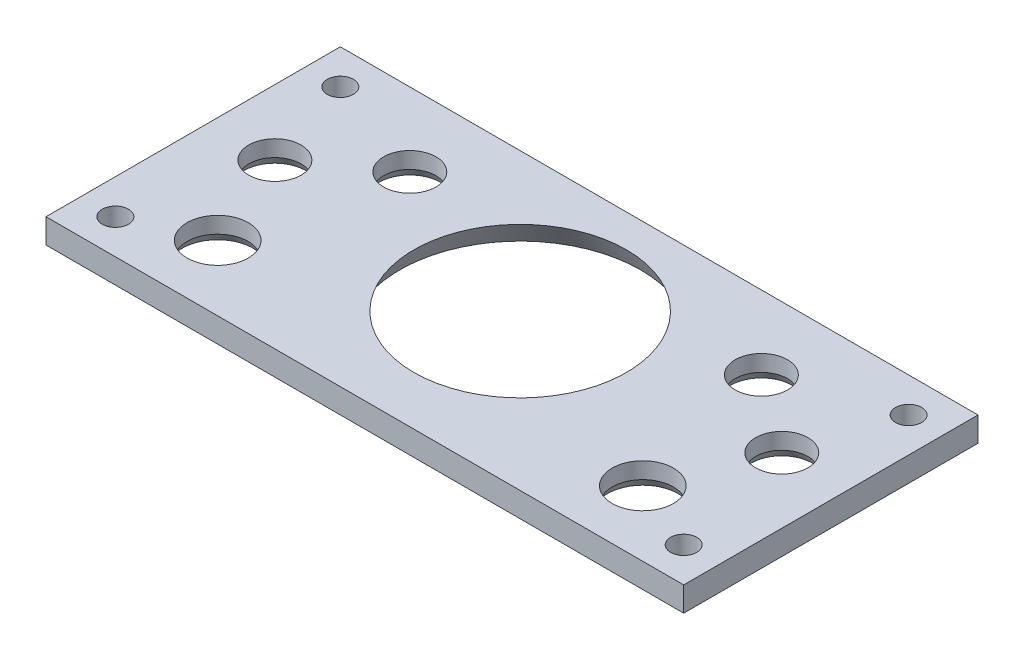
from build123d import *
from OCP.BRepFilletAPI import BRepFilletAPI_MakeChamfer

# Parameters (mm, degrees)
SKETCH1_W           = 78
SKETCH1_H           = 36
SKETCH1_R           = 13
SKETCH1_R_2         = 3.2
SKETCH1_R_3         = 3.75
BOSS_EXTRUDE1_DEPTH = 3
CHAMFER1_SIZE2      = 1.732050808
CHAMFER1_SIZE       = 3
CHAMFER2_SIZE       = 1
CHAMFER2_SIZE2      = 0.577350269
SKETCH2_R           = 1.6
CUT_EXTRUDE1_DEPTH  = 44.058100283


with BuildPart() as part:
    # Sketch1 → Boss-Extrude1 (new body)
    with BuildSketch(Plane(origin=(0, 0, 0), x_dir=(1, 0, 0), z_dir=(0, 1, 0))):
        Rectangle(SKETCH1_W, SKETCH1_H)
        with Locations(Location((0, 1, 0), (0, 0, 270))):
            Circle(SKETCH1_R, mode=Mode.SUBTRACT)
        with Locations(Location((-31, 2, 0), (0, 0, 270))):
            Circle(SKETCH1_R_2, mode=Mode.SUBTRACT)
        with Locations(Location((-26, -10, 0), (0, 0, 270))):
            Circle(SKETCH1_R_3, mode=Mode.SUBTRACT)
        with Locations(Location((31, 2, 0), (0, 0, 270))):
            Circle(SKETCH1_R_2, mode=Mode.SUBTRACT)
        with Locations(Location((26, -10, 0), (0, 0, 270))):
            Circle(SKETCH1_R_3, mode=Mode.SUBTRACT)
        with Locations(Location((21.5, 9, 0), (0, 0, 270))):
            Circle(SKETCH1_R_2, mode=Mode.SUBTRACT)
        with Locations(Location((-21.5, 9, 0), (0, 0, 270))):
            Circle(SKETCH1_R_2, mode=Mode.SUBTRACT)
    extrude(amount=BOSS_EXTRUDE1_DEPTH)

    # Chamfer1
    chamfer1_edges = [part.edges().sort_by_distance(p)[0] for p in [
        (0, 0, -14),
    ]]
    chamfer1_side = [part.faces().sort_by_distance(p)[0] for p in [
        (0, 0.034641016, -14),
    ]]
    chamfer(chamfer1_edges, length=CHAMFER1_SIZE - 0.0001, length2=CHAMFER1_SIZE2 - 0.0001, reference=chamfer1_side[0])  # a hair under: the kernel refuses the full size

    # Chamfer2: one chamfer whose edges measure the first distance from different faces: ONE call of the kernel's chamfer builder (chamfer() names one face for all edges)
    chamfer2_edges_1 = [part.edges().sort_by_distance(p)[0] for p in [
        (-31, 0, -5.2),
    ]]
    chamfer2_side_1 = [part.faces().sort_by_distance(p)[0] for p in [
        (-31, 1.5, -5.2),
    ]]
    chamfer2_edges_2 = [part.edges().sort_by_distance(p)[0] for p in [
        (-26, 0, 6.25),
    ]]
    chamfer2_side_2 = [part.faces().sort_by_distance(p)[0] for p in [
        (-26, 1.5, 6.25),
    ]]
    chamfer2_edges_3 = [part.edges().sort_by_distance(p)[0] for p in [
        (31, 0, -5.2),
    ]]
    chamfer2_side_3 = [part.faces().sort_by_distance(p)[0] for p in [
        (31, 1.5, -5.2),
    ]]
    chamfer2_edges_4 = [part.edges().sort_by_distance(p)[0] for p in [
        (26, 0, 6.25),
    ]]
    chamfer2_side_4 = [part.faces().sort_by_distance(p)[0] for p in [
        (26, 1.5, 6.25),
    ]]
    chamfer2_edges_5 = [part.edges().sort_by_distance(p)[0] for p in [
        (21.5, 0, -12.2),
    ]]
    chamfer2_side_5 = [part.faces().sort_by_distance(p)[0] for p in [
        (21.5, 1.5, -12.2),
    ]]
    chamfer2_edges_6 = [part.edges().sort_by_distance(p)[0] for p in [
        (-21.5, 0, -12.2),
    ]]
    chamfer2_side_6 = [part.faces().sort_by_distance(p)[0] for p in [
        (-21.5, 1.5, -12.2),
    ]]
    chamfer2 = BRepFilletAPI_MakeChamfer(part.part.solid().wrapped)
    for e in chamfer2_edges_1:
        chamfer2.Add(CHAMFER2_SIZE, CHAMFER2_SIZE2, e.wrapped, chamfer2_side_1[0].wrapped)  # the first distance lies on this face
    for e in chamfer2_edges_2:
        chamfer2.Add(CHAMFER2_SIZE, CHAMFER2_SIZE2, e.wrapped, chamfer2_side_2[0].wrapped)  # the first distance lies on this face
    for e in chamfer2_edges_3:
        chamfer2.Add(CHAMFER2_SIZE, CHAMFER2_SIZE2, e.wrapped, chamfer2_side_3[0].wrapped)  # the first distance lies on this face
    for e in chamfer2_edges_4:
        chamfer2.Add(CHAMFER2_SIZE, CHAMFER2_SIZE2, e.wrapped, chamfer2_side_4[0].wrapped)  # the first distance lies on this face
    for e in chamfer2_edges_5:
        chamfer2.Add(CHAMFER2_SIZE, CHAMFER2_SIZE2, e.wrapped, chamfer2_side_5[0].wrapped)  # the first distance lies on this face
    for e in chamfer2_edges_6:
        chamfer2.Add(CHAMFER2_SIZE, CHAMFER2_SIZE2, e.wrapped, chamfer2_side_6[0].wrapped)  # the first distance lies on this face
    add(Compound.cast(chamfer2.Shape()), mode=Mode.REPLACE)

    # Sketch2 → Cut-Extrude1 (cut, through all)
    with BuildSketch(Plane(origin=(0, 3, 0), x_dir=(1, 0, 0), z_dir=(0, 1, 0))):
        with Locations(Location((-34.757359313, -13.757359313, 0), (0, 0, 270))):
            Circle(SKETCH2_R)
        with Locations(Location((-34.757359313, 13.757359313, 0), (0, 0, 270))):
            Circle(SKETCH2_R)
        with Locations(Location((34.757359313, 13.757359313, 0), (0, 0, 270))):
            Circle(SKETCH2_R)
        with Locations(Location((34.757359313, -13.757359313, 0), (0, 0, 270))):
            Circle(SKETCH2_R)
    extrude(amount=-CUT_EXTRUDE1_DEPTH, mode=Mode.SUBTRACT)


solid = part.part
